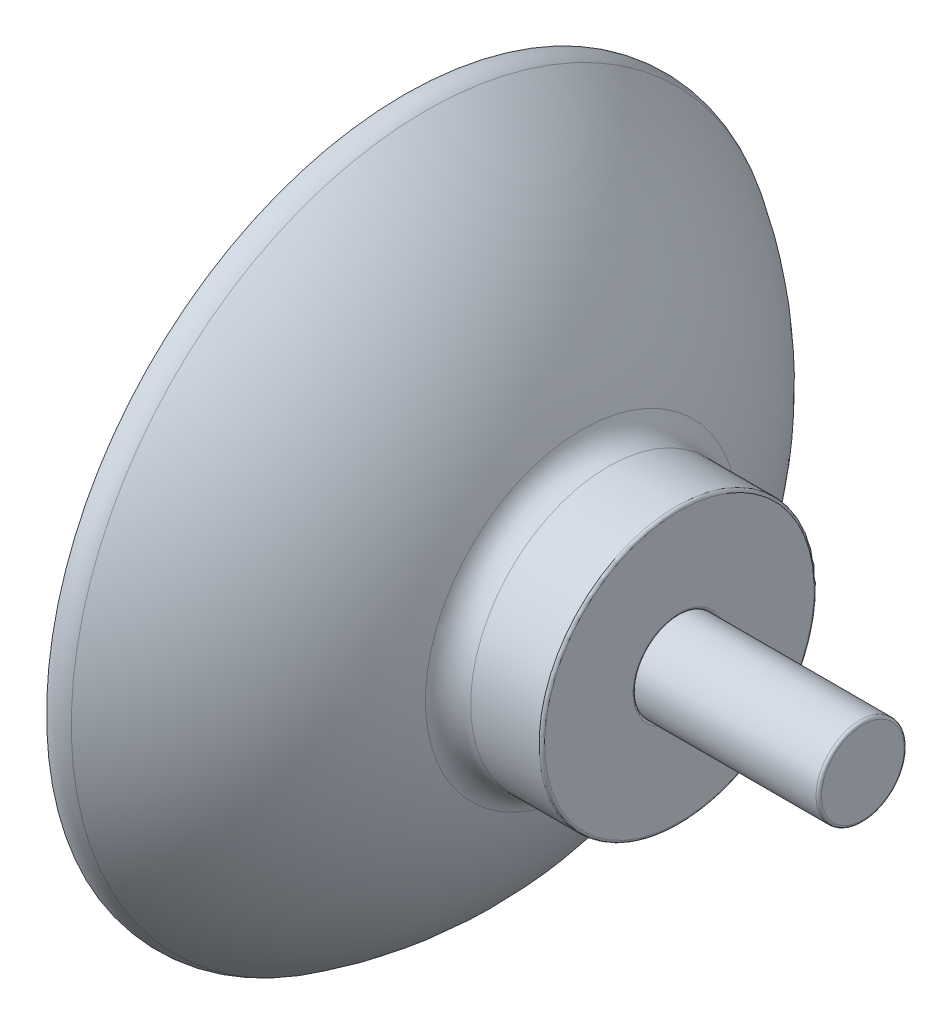
from build123d import *

# Parameters (mm, degrees)
FILLET1_R = 0.15
FILLET2_R = 1.5
FILLET3_R = 0.15


with BuildPart() as part:
    # Sketch1 → Revolve1 (revolve)
    with BuildSketch(Plane.XY):
        with BuildLine():
            Line((-4.6e-16, 4.000000000000002), (0, 0))
            Line((0, 0), (2, 0))
            Line((2, 0), (2, 4.75))
            Line((2, 4.75), (4, 4.75))
            Line((4, 4.75), (4, 2.375))
            Line((4, 2.375), (5, 2.375))
            Line((5, 2.375), (4.999999999999999, 7.5))
            Line((4.999999999999999, 7.5), (-8.7e-16, 7.5))
            ThreePointArc((0, 7.5), (-3.6948542111989937, 14.794116631040804), (-9.999999999999998, 20))
            Line((-10, 20), (-10, 19.5))
            ThreePointArc((-9.999999999999995, 19.500000000000004), (-3.297071481987519, 12.848663560008053), (7.11e-15, 4.000000000000002))
        make_face()
    revolve(axis=Axis((0, 0, 0), (-1, -1.2e-16, 0)))

    # Fillet1
    fillet1_edges = [part.edges().sort_by_distance(p)[0] for p in [
        (5, -2.374999999999999, -2.9e-16),
        (4, -2.374999999999999, -2.9e-16),
        (5.000000000000001, -7.499999999999998, -9.2e-16),
    ]]
    fillet(fillet1_edges, radius=FILLET1_R)

    # Fillet2
    # the kernel refuses this fillet: 1.5 mm, written as the material it adds along each edge
    with BuildSketch(Plane(origin=(2.26e-15, 0, 0), x_dir=(-1.2e-16, 1, 0), z_dir=(0, 0, 1))) as fillet2_piece_1:
        with BuildLine():
            CenterArc((9, -1.1172309258012287), FILLET2_R, 108.1567582497087, 71.84324175029133)
            ThreePointArc((8.532573186973417, 0.308080329491387), (8.018361800934953, 0.14708482432521688), (7.5, 0))
            Line((7.5, 0), (7.5, -1.1172309258012287))
        make_face()
    revolve(axis=Axis((2.26e-15, 0, 0), (-1, -1.2e-16, 0)))
    # the kernel refuses this fillet: 1.5 mm, written as the material it takes off along each edge
    with BuildSketch(Plane(origin=(-9.999999999999996, -1.22e-15, 0), x_dir=(-9e-17, 1, 0), z_dir=(0, 0, 1))) as fillet2_2_piece_1:
        with BuildLine():
            CenterArc((18.05169355974905, -0.39039525500277056), FILLET2_R, 328.3676814772994, 46.718016592573825)
            Line((19.499999999999662, -9.055e-14), (20, 1.78e-15))
            ThreePointArc((20, 1.78e-15), (19.674391539993568, -0.5942328025349592), (19.328840414867702, -1.1770946324402587))
        make_face()
    revolve(axis=Axis((-9.999999999999996, -1.22e-15, 0), (-1, -1.2e-16, 0)), mode=Mode.SUBTRACT)


with BuildPart() as body_2:
    # Sketch2 → Revolve2 (revolve)
    with BuildSketch(Plane.XY):
        Polygon((2.0000000000000004, 0), (2, 4.75), (4, 4.75), (4, 2.4), (15.000000000000002, 2.4), (15, 1.12e-15), align=None)
    revolve(axis=Axis((15, 1.12e-15, 0), (-1, -9e-17, 0)))

    # Fillet3
    fillet3_edges = [body_2.edges().sort_by_distance(p)[0] for p in [
        (15.000000000000002, -2.3999999999999972, -2.9e-16),
    ]]
    fillet(fillet3_edges, radius=FILLET3_R)


solid = Compound([part.part, body_2.part])
